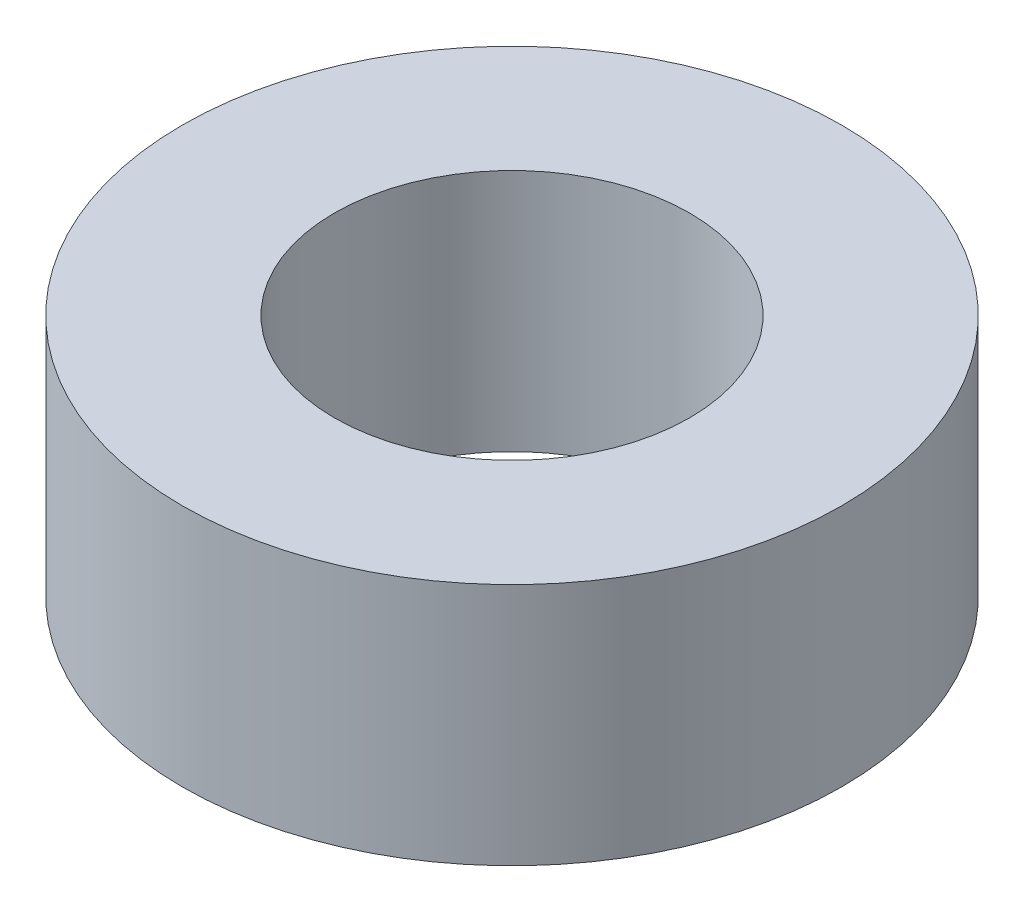
from build123d import *

# Parameters (mm, degrees)
SKETCH1_R           = 32.5
BOSS_EXTRUDE1_DEPTH = 24
SKETCH2_R           = 17.5
CUT_EXTRUDE1_DEPTH  = 52.850747343


with BuildPart() as part:
    # Sketch1 → Boss-Extrude1 (new body)
    with BuildSketch(Plane(origin=(0, 0, 0), x_dir=(1, 0, 0), z_dir=(0, 1, 0))):
        Circle(SKETCH1_R)
    extrude(amount=BOSS_EXTRUDE1_DEPTH)

    # Sketch2 → Cut-Extrude1 (cut, through all)
    with BuildSketch(Plane(origin=(0, 0, 0), x_dir=(1, 0, 0), z_dir=(0, 1, 0))):
        Circle(SKETCH2_R)
    extrude(amount=CUT_EXTRUDE1_DEPTH, mode=Mode.SUBTRACT)


solid = part.part
